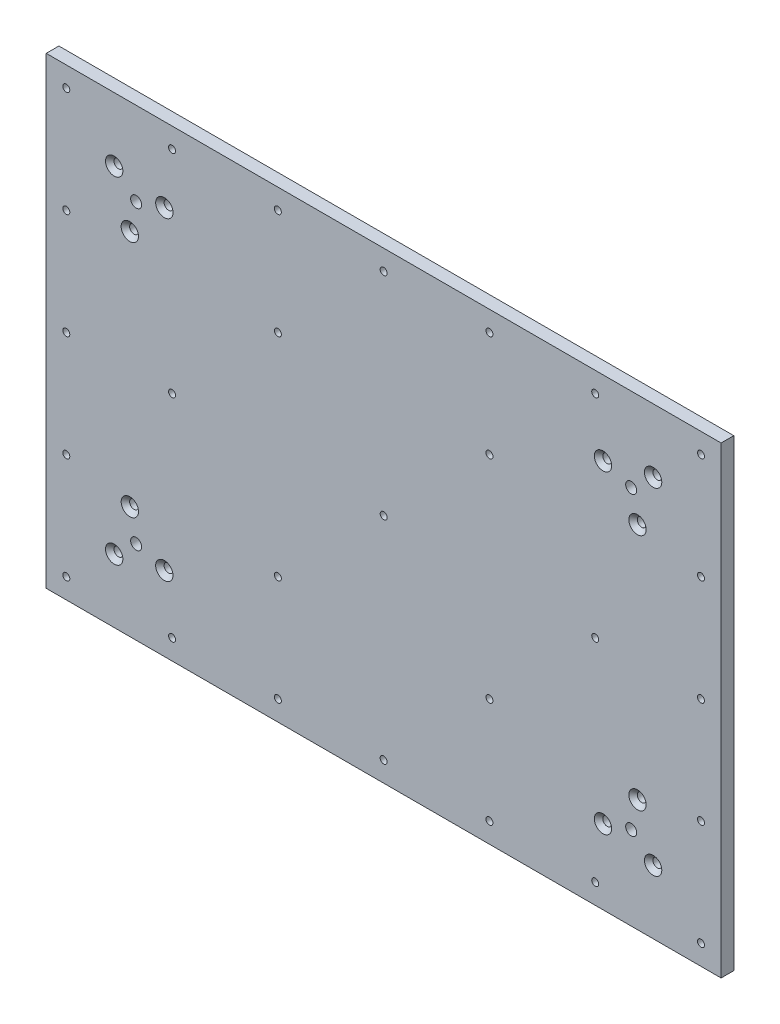
from build123d import *

# Parameters (mm, degrees)
SKETCH_1_W                  = 319
SKETCH_1_H                  = 219
EXTRUDE_1_DEPTH             = 6
HOLE_WIZARD_M41_D           = 3.3
HOLE_WIZARD_M41_CSINK_D     = 4.05
HOLE_WIZARD_M41_CSINK_ANGLE = 90
PATTERN_LINEAR_3_COUNT      = 7
PATTERN_LINEAR_3_PITCH      = 50
PATTERN_LINEAR_3_COUNT_DIR2 = 5
PATTERN_LINEAR_3_PITCH_DIR2 = 50
SKETCH_8_R                  = 2.6
CUT_EXTRUDE_2_DEPTH         = 194.562651356
SKETCH_9_R                  = 2.1
CUT_EXTRUDE_3_DEPTH         = 194.562651356
CHAMFER_1_SIZE              = 2
CHAMFER_1_OF_MIRROR_1_SIZE  = 2


# Read off the part's stored shape, not the designer's step: Зеркальное отражение2
with BuildPart() as part:
    # Эскиз1 → Бобышка-Вытянуть1 (new body)
    with BuildSketch(Plane.XY):
        Rectangle(SKETCH_1_W, SKETCH_1_H)
    extrude(amount=EXTRUDE_1_DEPTH)

    # Отверстие обработанное метчиком M41 (through all)
    with Locations(Plane(origin=(0, 0, 0), x_dir=(-1, 0, 0), z_dir=(0, 0, -1))):
        with Locations((-150, -100)):
            hole_wizard_m41 = CounterSinkHole(HOLE_WIZARD_M41_D / 2, HOLE_WIZARD_M41_CSINK_D / 2, counter_sink_angle=HOLE_WIZARD_M41_CSINK_ANGLE)

    # Линейный массив3: Hole Wizard M41 7 × 5, 8 skipped
    with Locations(*[(-i * PATTERN_LINEAR_3_PITCH, j * PATTERN_LINEAR_3_PITCH_DIR2, 0) for i in range(PATTERN_LINEAR_3_COUNT) for j in range(PATTERN_LINEAR_3_COUNT_DIR2) if (i, j) not in ((0, 0), (1, 1), (1, 3), (2, 2), (3, 1), (3, 3), (4, 2), (5, 1), (5, 3))]):
        add(hole_wizard_m41, mode=Mode.SUBTRACT)

    # Эскиз8 → Вырез-Вытянуть2 (cut, through all)
    with BuildSketch(Plane(origin=(0, 0, 0), x_dir=(-1, 0, 0), z_dir=(0, 0, -1))):
        with Locations((-117, 70)):
            Circle(SKETCH_8_R)
        with Locations((117, 70)):
            Circle(SKETCH_8_R)
        with Locations((117, -70)):
            Circle(SKETCH_8_R)
        with Locations((-117, -70)):
            Circle(SKETCH_8_R)
    extrude(amount=-CUT_EXTRUDE_2_DEPTH, mode=Mode.SUBTRACT)

    # Эскиз9 → Вырез-Вытянуть3 (cut, through all)
    with BuildSketch(Plane(origin=(0, 0, 0), x_dir=(-1, 0, 0), z_dir=(0, 0, -1))):
        with Locations((-127.359161028, 79.417419116)):
            Circle(SKETCH_9_R)
        with Locations((-103.664695294, 74.262587054)):
            Circle(SKETCH_9_R)
        with Locations((-119.976143679, 56.31999383)):
            Circle(SKETCH_9_R)
    cut_extrude_3 = extrude(amount=-CUT_EXTRUDE_3_DEPTH, mode=Mode.SUBTRACT)

    # Фаска1
    chamfer_1_edges = [part.edges().sort_by_distance(p)[0] for p in [
        (129.459161028, 79.417419116, 6),
        (105.764695294, 74.262587054, 6),
        (122.076143679, 56.31999383, 6),
    ]]
    chamfer(chamfer_1_edges, length=CHAMFER_1_SIZE)

    # Зеркальное отражение1: Вырез-Вытянуть3 across plane
    add(cut_extrude_3.mirror(Plane(origin=(0, 0, 0), x_dir=(0, 0, 1), z_dir=(1, 0, 0))), mode=Mode.SUBTRACT)

    # Фаска1 of Зеркальное отражение1
    chamfer_1_of_mirror_1_edges = [part.edges().sort_by_distance(p)[0] for p in [
        (-129.459161028, 79.417419116, 6),
        (-105.764695294, 74.262587054, 6),
        (-122.076143679, 56.31999383, 6),
    ]]
    chamfer(chamfer_1_of_mirror_1_edges, length=CHAMFER_1_OF_MIRROR_1_SIZE)

    # Зеркальное отражение2 outline → Зеркальное отражение2 (revolve, cut)
    with BuildSketch(Plane(origin=(127.359161028, -79.417419116, 0), x_dir=(1, 0, 0), z_dir=(0, -1, 0))):
        Polygon((4.1, 6), (0, 6), (0, 0), (2.1, 0), (2.1, 4), align=None)
    revolve(axis=Axis((127.359161028, -79.417419116, 0), (0, 0, 1)), mode=Mode.SUBTRACT)

    # Mirror 2 2 outline → Mirror 2 2 (revolve, cut)
    with BuildSketch(Plane(origin=(103.664695294, -74.262587054, 0), x_dir=(1, 0, 0), z_dir=(0, -1, 0))):
        Polygon((4.1, 6), (0, 6), (0, 0), (2.1, 0), (2.1, 4), align=None)
    revolve(axis=Axis((103.664695294, -74.262587054, 0), (0, 0, 1)), mode=Mode.SUBTRACT)

    # Mirror 2 3 outline → Mirror 2 3 (revolve, cut)
    with BuildSketch(Plane(origin=(119.976143679, -56.31999383, 0), x_dir=(1, 0, 0), z_dir=(0, -1, 0))):
        Polygon((4.1, 6), (0, 6), (0, 0), (2.1, 0), (2.1, 4), align=None)
    revolve(axis=Axis((119.976143679, -56.31999383, 0), (0, 0, 1)), mode=Mode.SUBTRACT)

    # Mirror 2 4 outline → Mirror 2 4 (revolve, cut)
    with BuildSketch(Plane(origin=(-127.359161028, -79.417419116, 0), x_dir=(1, 0, 0), z_dir=(0, -1, 0))):
        Polygon((4.1, 6), (0, 6), (0, 0), (2.1, 0), (2.1, 4), align=None)
    revolve(axis=Axis((-127.359161028, -79.417419116, 0), (0, 0, 1)), mode=Mode.SUBTRACT)

    # Mirror 2 5 outline → Mirror 2 5 (revolve, cut)
    with BuildSketch(Plane(origin=(-103.664695294, -74.262587054, 0), x_dir=(1, 0, 0), z_dir=(0, -1, 0))):
        Polygon((4.1, 6), (0, 6), (0, 0), (2.1, 0), (2.1, 4), align=None)
    revolve(axis=Axis((-103.664695294, -74.262587054, 0), (0, 0, 1)), mode=Mode.SUBTRACT)

    # Mirror 2 6 outline → Mirror 2 6 (revolve, cut)
    with BuildSketch(Plane(origin=(-119.976143679, -56.31999383, 0), x_dir=(1, 0, 0), z_dir=(0, -1, 0))):
        Polygon((4.1, 6), (0, 6), (0, 0), (2.1, 0), (2.1, 4), align=None)
    revolve(axis=Axis((-119.976143679, -56.31999383, 0), (0, 0, 1)), mode=Mode.SUBTRACT)


solid = part.part
